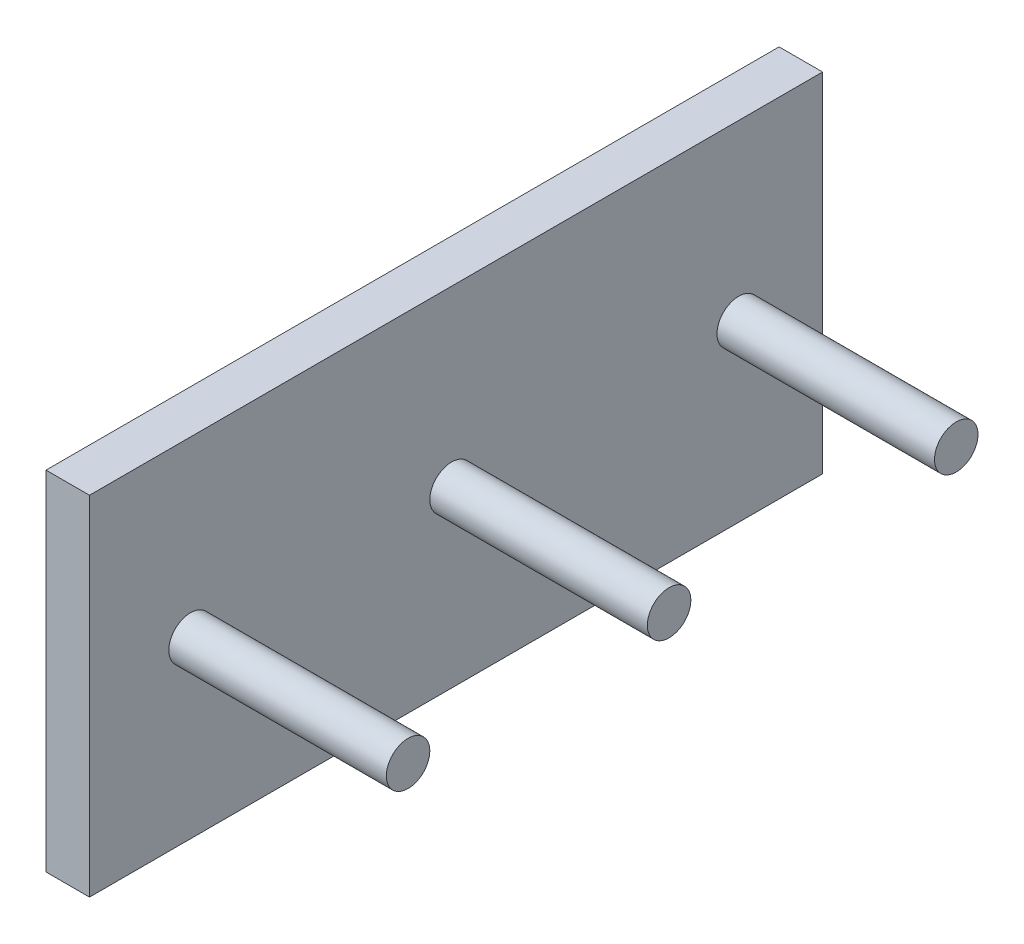
from build123d import *

# Parameters (mm, degrees)
SKETCH3_W           = 168.5
SKETCH3_H           = 80
BOSS_EXTRUDE1_DEPTH = 10
SKETCH4_R           = 5
BOSS_EXTRUDE2_DEPTH = 50
CUT_EXTRUDE1_START  = -10
CUT_EXTRUDE1_DEPTH  = 0.2


# Read off the part's stored shape, not the designer's step: Cut-Extrude1
with BuildPart() as part:
    # Sketch3 → Boss-Extrude1 (new body)
    with BuildSketch(Plane(origin=(0, 0, 0), x_dir=(0, 0, -1), z_dir=(1, 0, 0))):
        with Locations((-23.424575586, -20.604899774)):
            Rectangle(SKETCH3_W, SKETCH3_H)
    extrude(amount=-BOSS_EXTRUDE1_DEPTH)

    # Sketch4 → Boss-Extrude2 (add)
    with BuildSketch(Plane(origin=(0, 0, 0), x_dir=(0, 0, -1), z_dir=(1, 0, 0))):
        with Locations((41.54546204, -20.604899774)):
            Circle(SKETCH4_R)
        with Locations((-24.45453796, -20.604899774)):
            Circle(SKETCH4_R)
        with Locations((-84.45453796, -20.604899774)):
            Circle(SKETCH4_R)
    extrude(amount=BOSS_EXTRUDE2_DEPTH)

    # Cut-Extrude1 outline → Cut-Extrude1 (cut)
    # profile 1 of 9: a face of its own
    with BuildSketch(Plane.YZ.offset(CUT_EXTRUDE1_START)):
        with BuildLine():
            add(Edge.make_bspline(
                [(-24.952667893, -45.734619099), (-24.981132553, -45.735215217), (-25.037509108, -45.736395877), (-25.120290499, -45.749967563), (-25.20069136, -45.769851831), (-25.277717869, -45.799821321), (-25.352779189, -45.836400186), (-25.423906356, -45.882815283), (-25.492673589, -45.936615825), (-25.557247185, -45.998332169), (-25.61652552, -46.065865238), (-25.669256883, -46.137242589), (-25.713224576, -46.212581051), (-25.74910284, -46.291471924), (-25.777163959, -46.373933329), (-25.797495633, -46.459937533), (-25.809974028, -46.549626304), (-25.811269212, -46.610586741), (-25.811927709, -46.641580236)],
                knots=[0, 0, 0, 0, 0.061484255, 0.121774528, 0.18091956, 0.240256115, 0.300114444, 0.361145948, 0.423500582, 0.488669361, 0.553954105, 0.617581261, 0.680238427, 0.742187389, 0.804663212, 0.868258989, 0.933020257, 1, 1, 1, 1], degree=3))
            add(Edge.make_bspline(
                [(-25.811927709, -46.641580236), (-25.811463994, -46.665560869), (-25.810542405, -46.713220123), (-25.8023951, -46.783713724), (-25.790867942, -46.852783209), (-25.772567179, -46.919561879), (-25.750363064, -46.984910102), (-25.723023291, -47.048543665), (-25.690259829, -47.110493407), (-25.652799343, -47.1711065), (-25.609204103, -47.230228787), (-25.558428145, -47.287305732), (-25.501871866, -47.344210065), (-25.437999426, -47.399262203), (-25.367842737, -47.453575698), (-25.290745406, -47.506079684), (-25.207127378, -47.557860957), (-25.148285479, -47.590350702), (-25.118032477, -47.607054996)],
                knots=[0, 0, 0, 0, 0.057208269, 0.11369606, 0.169177916, 0.224159217, 0.278719878, 0.333794217, 0.389241459, 0.445822073, 0.503704281, 0.564293892, 0.627975416, 0.69503826, 0.765372726, 0.839611443, 0.91753775, 1, 1, 1, 1], degree=3))
            Line((-25.118032477, -47.607054996), (-24.957120017, -47.338655557))
            add(Edge.make_bspline(
                [(-24.957120017, -47.338655557), (-24.998906994, -47.313692584), (-25.078969231, -47.265864493), (-25.187153311, -47.186080046), (-25.279103267, -47.103409476), (-25.35428419, -47.017240581), (-25.413474251, -46.928099328), (-25.455386276, -46.835403793), (-25.481526482, -46.739466351), (-25.484701561, -46.674175813), (-25.486286683, -46.641580236)],
                knots=[0, 0, 0, 0, 0.159004299, 0.3046461, 0.438546905, 0.562322299, 0.677432543, 0.786897393, 0.893610889, 1, 1, 1, 1], degree=3))
            add(Edge.make_bspline(
                [(-25.486286683, -46.641580236), (-25.485511373, -46.61374287), (-25.483974319, -46.558555226), (-25.469205306, -46.477309477), (-25.446515732, -46.398404556), (-25.41402103, -46.323466721), (-25.374706832, -46.253529985), (-25.327221371, -46.192201054), (-25.27405717, -46.13918208), (-25.214745762, -46.095812383), (-25.150958063, -46.062538351), (-25.085484164, -46.036964117), (-25.017295534, -46.022771801), (-24.971384614, -46.020633889), (-24.94821577, -46.019554996)],
                knots=[0, 0, 0, 0, 0.091263605, 0.180930311, 0.27008822, 0.360156133, 0.448342532, 0.532665842, 0.613833704, 0.693981527, 0.772715977, 0.849335172, 0.923967327, 1, 1, 1, 1], degree=3))
            add(Edge.make_bspline(
                [(-24.94821577, -46.019554996), (-24.921780856, -46.020892406), (-24.86804254, -46.023611166), (-24.788758569, -46.046590438), (-24.710297452, -46.082739397), (-24.661764161, -46.116088367), (-24.636567132, -46.133402151)],
                knots=[0, 0, 0, 0, 0.234723374, 0.477158319, 0.728556284, 1, 1, 1, 1], degree=3))
            add(Edge.make_bspline(
                [(-24.636567132, -46.133402151), (-24.618381799, -46.147617637), (-24.580203968, -46.177461271), (-24.52337579, -46.228767015), (-24.464757652, -46.288970561), (-24.402111222, -46.356011643), (-24.33835015, -46.432332374), (-24.270433926, -46.515542333), (-24.200945353, -46.607765977), (-24.154343097, -46.672444806), (-24.1302971, -46.705818017)],
                knots=[0, 0, 0, 0, 0.090279215, 0.189529918, 0.299197872, 0.418925887, 0.548376285, 0.68813637, 0.839083502, 1, 1, 1, 1], degree=3))
            add(Edge.make_bspline(
                [(-24.1302971, -46.705818017), (-24.106504024, -46.739222642), (-24.061013475, -46.803089741), (-23.993500017, -46.892405741), (-23.931774507, -46.972274647), (-23.875255867, -47.042341469), (-23.823936433, -47.102575389), (-23.778309017, -47.153451055), (-23.737139644, -47.19367246), (-23.710432141, -47.216038594), (-23.69844113, -47.226080437)],
                knots=[0, 0, 0, 0, 0.181535301, 0.347081672, 0.495567816, 0.628357302, 0.74551967, 0.845830751, 0.930781807, 1, 1, 1, 1], degree=3))
            add(Edge.make_bspline(
                [(-23.69844113, -47.226080437), (-23.679753047, -47.240116246), (-23.643000423, -47.267719547), (-23.58555573, -47.304155852), (-23.526751768, -47.33512495), (-23.46643052, -47.359402209), (-23.405438834, -47.379845778), (-23.342980918, -47.393596187), (-23.279337029, -47.40220624), (-23.236507639, -47.403087971), (-23.215067733, -47.403529355)],
                knots=[0, 0, 0, 0, 0.133506769, 0.262558979, 0.388264447, 0.512667355, 0.63372227, 0.75539386, 0.877552945, 1, 1, 1, 1], degree=3))
            add(Edge.make_bspline(
                [(-23.215067733, -47.403529355), (-23.181476437, -47.402345344), (-23.115011837, -47.400002629), (-23.017919583, -47.38019016), (-22.925221905, -47.348918321), (-22.837836531, -47.305107958), (-22.75803882, -47.248631645), (-22.684910871, -47.183275654), (-22.623435085, -47.105432377), (-22.56972129, -47.020022498), (-22.527678915, -46.926535646), (-22.495964311, -46.828572469), (-22.477994484, -46.725977268), (-22.475415691, -46.656487282), (-22.474107196, -46.621227672)],
                knots=[0, 0, 0, 0, 0.083785371, 0.165779888, 0.246280008, 0.327460928, 0.408796954, 0.489715241, 0.571376032, 0.655523321, 0.741019483, 0.826546761, 0.911988852, 1, 1, 1, 1], degree=3))
            add(Edge.make_bspline(
                [(-22.474107196, -46.621227672), (-22.475397654, -46.583813381), (-22.477963962, -46.509408298), (-22.500277437, -46.399962224), (-22.53719876, -46.29458786), (-22.579098471, -46.209821469), (-22.620946256, -46.143479607), (-22.659064239, -46.092885771), (-22.702947373, -46.041616369), (-22.752712547, -45.989257848), (-22.808816385, -45.936697393), (-22.870874653, -45.88315469), (-22.9385081, -45.828504532), (-22.986790326, -45.79334743), (-23.011542092, -45.775324227)],
                knots=[0, 0, 0, 0, 0.107232799, 0.213251813, 0.318830447, 0.426793531, 0.483645951, 0.543603822, 0.60830765, 0.67712676, 0.750685636, 0.828713418, 0.912190348, 1, 1, 1, 1], degree=3))
            Line((-23.011542092, -45.775324227), (-23.206799504, -46.032911366))
            add(Edge.make_bspline(
                [(-23.206799504, -46.032911366), (-23.186761906, -46.048465176), (-23.148174178, -46.078418178), (-23.094134484, -46.123892784), (-23.044770964, -46.166754058), (-23.00189474, -46.20898192), (-22.963157805, -46.248346143), (-22.929992883, -46.286552317), (-22.902075021, -46.323050621), (-22.87228122, -46.369058105), (-22.842747821, -46.426859178), (-22.817756871, -46.499416578), (-22.802739065, -46.575241271), (-22.800753431, -46.626884579), (-22.799748222, -46.653028554)],
                knots=[0, 0, 0, 0, 0.098469431, 0.189629101, 0.274184089, 0.352183161, 0.423198873, 0.488550946, 0.548473346, 0.601440164, 0.701198082, 0.799591802, 0.898545098, 1, 1, 1, 1], degree=3))
            add(Edge.make_bspline(
                [(-22.799748222, -46.653028554), (-22.800847407, -46.685827685), (-22.802967081, -46.749077719), (-22.826117354, -46.838876005), (-22.862568041, -46.919696922), (-22.913653771, -46.989141035), (-22.974179243, -47.046959579), (-23.043828633, -47.088783816), (-23.120738384, -47.11395718), (-23.174388315, -47.117029019), (-23.201711363, -47.118593458)],
                knots=[0, 0, 0, 0, 0.143073084, 0.275902964, 0.402370856, 0.528413645, 0.650356379, 0.765895086, 0.880774131, 1, 1, 1, 1], degree=3))
            add(Edge.make_bspline(
                [(-23.201711363, -47.118593458), (-23.218721633, -47.118236835), (-23.252769987, -47.117523008), (-23.303072349, -47.107567299), (-23.353247635, -47.094777193), (-23.403070264, -47.074509235), (-23.453411575, -47.046528138), (-23.505138437, -47.009784157), (-23.558706773, -46.963507795), (-23.593547748, -46.928059362), (-23.611942733, -46.909343658)],
                knots=[0, 0, 0, 0, 0.107285214, 0.214745861, 0.32293856, 0.434116163, 0.553412311, 0.686072985, 0.834255992, 1, 1, 1, 1], degree=3))
            add(Edge.make_bspline(
                [(-23.611942733, -46.909343658), (-23.618144892, -46.902393699), (-23.632879802, -46.885882186), (-23.6570028, -46.855696168), (-23.686759601, -46.815833772), (-23.723578095, -46.767335918), (-23.766287707, -46.709308383), (-23.814342341, -46.641744786), (-23.869302007, -46.565398252), (-23.907726347, -46.511221943), (-23.928043494, -46.482575829)],
                knots=[0, 0, 0, 0, 0.052594282, 0.124951974, 0.218093899, 0.333502411, 0.468789179, 0.624937586, 0.801683048, 1, 1, 1, 1], degree=3))
            add(Edge.make_bspline(
                [(-23.928043494, -46.482575829), (-23.953118156, -46.448117179), (-24.001671763, -46.38139278), (-24.074620273, -46.286453404), (-24.145965035, -46.200371163), (-24.215250435, -46.122843829), (-24.28195092, -46.05310549), (-24.346868948, -45.991929844), (-24.409539431, -45.938693548), (-24.489887411, -45.881380971), (-24.588567394, -45.822817806), (-24.709469797, -45.772524439), (-24.830842173, -45.740812224), (-24.91241866, -45.736665206), (-24.952667893, -45.734619099)],
                knots=[0, 0, 0, 0, 0.09697231, 0.187773439, 0.272396139, 0.351320997, 0.424334774, 0.491908784, 0.55423322, 0.611267658, 0.716347845, 0.814540086, 0.908495456, 1, 1, 1, 1], degree=3))
        make_face()
    # profile 2 of 9: a face of its own
    with BuildSketch(Plane.YZ.offset(CUT_EXTRUDE1_START)):
        with BuildLine():
            add(Edge.make_bspline(
                [(-15.989955864, -58.653934749), (-15.834604127, -58.650632738), (-15.527208454, -58.644099024), (-15.074757903, -58.58859491), (-14.637081002, -58.503095552), (-14.216240998, -58.381037987), (-13.811420724, -58.221571693), (-13.421875442, -58.028539611), (-13.048263836, -57.79892184), (-12.815223613, -57.621367306), (-12.69792862, -57.531999653)],
                knots=[0, 0, 0, 0, 0.131331511, 0.259866667, 0.384897096, 0.508129446, 0.629848036, 0.752360482, 0.875356816, 1, 1, 1, 1], degree=3))
            add(Edge.make_bspline(
                [(-12.69792862, -57.531999653), (-12.574967626, -57.428703375), (-12.334700298, -57.226861149), (-12.023466889, -56.883654923), (-11.755930303, -56.5244829), (-11.538179004, -56.142627212), (-11.368509875, -55.740386898), (-11.250187146, -55.317185724), (-11.172436057, -54.874609611), (-11.165058766, -54.571885283), (-11.161310031, -54.418057346)],
                knots=[0, 0, 0, 0, 0.133704032, 0.26125936, 0.385087027, 0.506324071, 0.626690717, 0.74794424, 0.871919055, 1, 1, 1, 1], degree=3))
            add(Edge.make_bspline(
                [(-11.161310031, -54.418057346), (-11.165020067, -54.264230037), (-11.17230101, -53.962344026), (-11.250272758, -53.520569326), (-11.36933364, -53.099006935), (-11.534136212, -52.695735667), (-11.754770558, -52.317316899), (-12.017842869, -51.956542771), (-12.329667919, -51.615267354), (-12.568372128, -51.412679902), (-12.690296409, -51.309203179)],
                knots=[0, 0, 0, 0, 0.128405859, 0.251996429, 0.373557547, 0.493956724, 0.614886383, 0.738608902, 0.866487811, 1, 1, 1, 1], degree=3))
            add(Edge.make_bspline(
                [(-12.690296409, -51.309203179), (-12.807497851, -51.219675188), (-13.040926766, -51.041363203), (-13.415951696, -50.814221519), (-13.804843908, -50.618264064), (-14.211292699, -50.460342061), (-14.633760276, -50.338408126), (-15.072207281, -50.252568699), (-15.525508885, -50.197008164), (-15.833755031, -50.190543825), (-15.989955864, -50.187268083)],
                knots=[0, 0, 0, 0, 0.12438913, 0.24774456, 0.369366759, 0.491503751, 0.615172269, 0.739947855, 0.868221024, 1, 1, 1, 1], degree=3))
            add(Edge.make_bspline(
                [(-15.989955864, -50.187268083), (-16.146997463, -50.190451268), (-16.457021285, -50.196735357), (-16.914385465, -50.253829085), (-17.355933127, -50.349987478), (-17.785336091, -50.473984909), (-18.196410816, -50.645877153), (-18.59488548, -50.847624813), (-18.974963486, -51.092919235), (-19.338092388, -51.366447845), (-19.673690767, -51.668220859), (-19.96465526, -51.998891273), (-20.21491488, -52.348655263), (-20.415879876, -52.723048884), (-20.575471559, -53.116769998), (-20.68708594, -53.531925823), (-20.75465548, -53.968080767), (-20.763305833, -54.26601521), (-20.767720287, -54.418057346)],
                knots=[0, 0, 0, 0, 0.066265407, 0.130817915, 0.194141102, 0.256880934, 0.319162696, 0.381914779, 0.445165087, 0.509808828, 0.573661908, 0.635281894, 0.695365993, 0.754784322, 0.814205886, 0.874292118, 0.935848656, 1, 1, 1, 1], degree=3))
            add(Edge.make_bspline(
                [(-20.767720287, -54.418057346), (-20.763273868, -54.570097831), (-20.754536354, -54.868867662), (-20.68701257, -55.306675969), (-20.575951599, -55.723719662), (-20.415841276, -56.11814894), (-20.214898679, -56.492520743), (-19.964761566, -56.842426611), (-19.672884981, -57.1729595), (-19.33889043, -57.477267119), (-18.975651066, -57.751135615), (-18.594079348, -57.99309363), (-18.19659343, -58.19578013), (-17.78477742, -58.366181562), (-17.356791507, -58.495410597), (-16.913948845, -58.586257111), (-16.457089529, -58.644763376), (-16.147020409, -58.650851055), (-15.989955864, -58.653934749)],
                knots=[0, 0, 0, 0, 0.064101467, 0.125963715, 0.186348455, 0.245723819, 0.305095951, 0.365133335, 0.426705411, 0.490749979, 0.555343459, 0.618353033, 0.681056327, 0.743289665, 0.806083675, 0.869283795, 0.933786114, 1, 1, 1, 1], degree=3))
        make_face()
        with BuildLine():
            add(Edge.make_bspline(
                [(-19.627976697, -54.420601416), (-19.623260494, -54.281831116), (-19.613928913, -54.007257254), (-19.518907637, -53.605915282), (-19.37505878, -53.220889207), (-19.168608937, -52.858720703), (-18.912633472, -52.522488121), (-18.602692465, -52.221425726), (-18.243407582, -51.959625243), (-17.842652883, -51.73500489), (-17.41054112, -51.551800864), (-16.954054854, -51.422981447), (-16.481406834, -51.340542891), (-16.159902655, -51.331551211), (-15.997588076, -51.327011672)],
                knots=[0, 0, 0, 0, 0.0783479, 0.155020818, 0.231975183, 0.310137929, 0.389846351, 0.470221393, 0.553574395, 0.640540896, 0.729520414, 0.818318816, 0.908276449, 1, 1, 1, 1], degree=3))
            add(Edge.make_bspline(
                [(-15.997588076, -51.327011672), (-15.872005775, -51.330397195), (-15.62526941, -51.33704886), (-15.261089622, -51.376106329), (-14.912388543, -51.452765156), (-14.575299627, -51.548773893), (-14.256161146, -51.682148968), (-13.947264907, -51.835966932), (-13.656387723, -52.026024898), (-13.380183779, -52.238038481), (-13.128243745, -52.4689124), (-12.906842577, -52.714698996), (-12.720629884, -52.972587908), (-12.565983498, -53.240376863), (-12.448472017, -53.520209794), (-12.36388138, -53.810297302), (-12.311602832, -54.111739391), (-12.304594341, -54.316935453), (-12.30105362, -54.420601416)],
                knots=[0, 0, 0, 0, 0.070503408, 0.138520751, 0.205175423, 0.270690175, 0.334949695, 0.399023848, 0.464115338, 0.529616256, 0.594293975, 0.655642306, 0.71495908, 0.772521592, 0.828834671, 0.884867439, 0.941834518, 1, 1, 1, 1], degree=3))
            add(Edge.make_bspline(
                [(-12.30105362, -54.420601416), (-12.304528165, -54.525125673), (-12.311378091, -54.731191054), (-12.364302462, -55.034173973), (-12.447934347, -55.325391913), (-12.566044667, -55.605895935), (-12.720610942, -55.873711182), (-12.906855179, -56.131577794), (-13.128211334, -56.377429735), (-13.380307533, -56.608050586), (-13.65556096, -56.82074689), (-13.948191893, -57.007051677), (-14.255363774, -57.162712262), (-14.576486579, -57.290686191), (-14.911444593, -57.392861064), (-15.261547793, -57.463909453), (-15.625194156, -57.504471057), (-15.871980392, -57.51091259), (-15.997588076, -57.51419116)],
                knots=[0, 0, 0, 0, 0.058609208, 0.115545704, 0.172005201, 0.228288048, 0.285819656, 0.345104585, 0.406419982, 0.471062977, 0.53652873, 0.601329081, 0.665368835, 0.729415657, 0.795031618, 0.861553615, 0.929534443, 1, 1, 1, 1], degree=3))
            add(Edge.make_bspline(
                [(-15.997588076, -57.51419116), (-16.159895818, -57.509634467), (-16.481386457, -57.500608811), (-16.954134107, -57.418420248), (-17.409932589, -57.28875551), (-17.843140756, -57.109196066), (-18.244220254, -56.884289777), (-18.601912375, -56.619588542), (-18.912742412, -56.318856043), (-19.168580463, -55.982445188), (-19.375066214, -55.62032327), (-19.518905677, -55.235285007), (-19.613929414, -54.833946229), (-19.623260662, -54.559371935), (-19.627976697, -54.420601416)],
                knots=[0, 0, 0, 0, 0.091714371, 0.181663002, 0.270452517, 0.359238147, 0.446195944, 0.529825667, 0.610192664, 0.68989311, 0.768048033, 0.844994696, 0.921659941, 1, 1, 1, 1], degree=3))
        make_face(mode=Mode.SUBTRACT)
    # profile 3 of 9: a face of its own
    with BuildSketch(Plane.YZ.offset(CUT_EXTRUDE1_START)):
        with BuildLine():
            add(Edge.make_bspline(
                [(-14.249811633, -48.559062955), (-14.100491672, -48.556433557), (-13.803976545, -48.551212177), (-13.363056787, -48.515015744), (-12.930477821, -48.454742758), (-12.506264392, -48.366497741), (-12.089318506, -48.258750205), (-11.680168279, -48.122384559), (-11.279323599, -47.962486064), (-10.887447176, -47.779533173), (-10.510840883, -47.575151222), (-10.153315826, -47.350467278), (-9.816948189, -47.108215325), (-9.499703709, -46.849396738), (-9.208180716, -46.567856681), (-8.933503301, -46.272169495), (-8.681856251, -45.956644332), (-8.453155243, -45.622877075), (-8.247232381, -45.275811408), (-8.06843404, -44.916172297), (-7.918271563, -44.545030742), (-7.792280565, -44.164038489), (-7.699058526, -43.769541908), (-7.63111169, -43.365024277), (-7.585020324, -42.949598263), (-7.581191578, -42.66881626), (-7.579258749, -42.527071769)],
                knots=[0, 0, 0, 0, 0.044651779, 0.088668171, 0.132207846, 0.175179556, 0.218175953, 0.26092032, 0.304057092, 0.347169258, 0.390178367, 0.432113878, 0.473357381, 0.514075937, 0.554433565, 0.594455141, 0.634694671, 0.675001273, 0.715362885, 0.755284705, 0.794984396, 0.835002758, 0.875168701, 0.916068492, 0.95762966, 1, 1, 1, 1], degree=3))
            add(Edge.make_bspline(
                [(-7.579258749, -42.527071769), (-7.581409041, -42.411687958), (-7.585699964, -42.181438835), (-7.614210117, -41.8391489), (-7.660504692, -41.501270227), (-7.722744611, -41.16865663), (-7.807902967, -40.842032345), (-7.91037179, -40.520410888), (-8.028495355, -40.20259552), (-8.170210038, -39.890604043), (-8.330852121, -39.582412462), (-8.51160617, -39.276019394), (-8.716653264, -38.972800634), (-8.942759811, -38.670092234), (-9.19263246, -38.369692446), (-9.465421609, -38.072843664), (-9.758614714, -37.776163942), (-9.966493829, -37.584802966), (-10.072447851, -37.487268083)],
                knots=[0, 0, 0, 0, 0.059602645, 0.118937456, 0.177297226, 0.23571944, 0.293625312, 0.351536154, 0.410037148, 0.468661025, 0.528421226, 0.589501104, 0.65231576, 0.717412324, 0.78460646, 0.854061573, 0.925616562, 1, 1, 1, 1], degree=3))
            Line((-10.072447851, -37.487268083), (-10.998489518, -38.347163916))
            add(Edge.make_bspline(
                [(-10.998489518, -38.347163916), (-10.832693322, -38.501084531), (-10.50731501, -38.803156782), (-10.078547276, -39.298702167), (-9.715175256, -39.817953804), (-9.415634307, -40.353830787), (-9.178186657, -40.895634289), (-9.009670313, -41.435667689), (-8.900809788, -41.968936722), (-8.888097101, -42.323898382), (-8.881822851, -42.499086993)],
                knots=[0, 0, 0, 0, 0.141416926, 0.277533513, 0.408931547, 0.53715689, 0.660916574, 0.778177268, 0.890521088, 1, 1, 1, 1], degree=3))
            add(Edge.make_bspline(
                [(-8.881822851, -42.499086993), (-8.883318397, -42.606051803), (-8.886306143, -42.819742215), (-8.924750313, -43.1374149), (-8.979775066, -43.452151307), (-9.058821767, -43.762576892), (-9.161465241, -44.069248847), (-9.285943807, -44.372069738), (-9.434633545, -44.670875583), (-9.604422247, -44.963511576), (-9.790526751, -45.248294008), (-9.998426999, -45.515207816), (-10.21896838, -45.768733774), (-10.459669547, -46.002444758), (-10.714515748, -46.221659743), (-10.984443165, -46.426497338), (-11.272452626, -46.611670153), (-11.57462025, -46.779037534), (-11.88647979, -46.927047596), (-12.202322005, -47.062604849), (-12.525971878, -47.169152328), (-12.851053665, -47.2631902), (-13.182280191, -47.330710958), (-13.516695147, -47.381954374), (-13.856572524, -47.41352049), (-14.084381553, -47.417379133), (-14.198930223, -47.419319365)],
                knots=[0, 0, 0, 0, 0.039897159, 0.079705095, 0.119250487, 0.159088605, 0.199121103, 0.239850603, 0.281179432, 0.323575387, 0.366059846, 0.408029581, 0.449740774, 0.491367834, 0.533110233, 0.575139589, 0.617715896, 0.66078224, 0.703956598, 0.746511727, 0.788946646, 0.8310284, 0.872739592, 0.914992372, 0.957255817, 1, 1, 1, 1], degree=3))
            add(Edge.make_bspline(
                [(-14.198930223, -47.419319365), (-14.316053041, -47.41767024), (-14.549923232, -47.414377278), (-14.897862831, -47.378284253), (-15.242524346, -47.329809193), (-15.581837332, -47.253938255), (-15.91821146, -47.161401951), (-16.248270268, -47.042277141), (-16.575830699, -46.908805139), (-16.894213635, -46.750284507), (-17.204235043, -46.577150275), (-17.496764417, -46.381944061), (-17.774675667, -46.175110579), (-18.03308535, -45.947932013), (-18.277351632, -45.708552797), (-18.501362527, -45.449115273), (-18.710651006, -45.177228214), (-18.901468767, -44.890101966), (-19.070597406, -44.590042685), (-19.222387229, -44.282920639), (-19.346296375, -43.966599664), (-19.448460966, -43.643512205), (-19.531105205, -43.314210639), (-19.584799527, -42.976982281), (-19.623838656, -42.633988687), (-19.626586175, -42.402527718), (-19.627976697, -42.28538507)],
                knots=[0, 0, 0, 0, 0.042266522, 0.084397556, 0.126178976, 0.167853704, 0.209823139, 0.252040846, 0.294454579, 0.337446665, 0.380356918, 0.422557972, 0.464316953, 0.505328561, 0.546677025, 0.587688633, 0.628959954, 0.670481466, 0.712024416, 0.753237786, 0.794056968, 0.8345291, 0.875516704, 0.916486009, 0.957733478, 1, 1, 1, 1], degree=3))
            add(Edge.make_bspline(
                [(-19.627976697, -42.28538507), (-19.624503514, -42.145296791), (-19.617660104, -41.869272869), (-19.56504079, -41.46331693), (-19.482702562, -41.072698879), (-19.362117155, -40.699785869), (-19.208261071, -40.344033591), (-19.022805881, -40.003690874), (-18.798911629, -39.682389845), (-18.545729494, -39.3780175), (-18.264662965, -39.097048847), (-17.960878322, -38.843774361), (-17.636698534, -38.622357721), (-17.293399495, -38.429341981), (-16.929061317, -38.269771316), (-16.544100741, -38.140087583), (-16.140518965, -38.036150348), (-15.861546104, -37.996040029), (-15.72028439, -37.975729621)],
                knots=[0, 0, 0, 0, 0.065695602, 0.129443791, 0.191706383, 0.252719989, 0.312945246, 0.373297803, 0.434207579, 0.496345511, 0.558790825, 0.620368518, 0.681606057, 0.742692241, 0.804853088, 0.867877295, 0.933097866, 1, 1, 1, 1], degree=3))
            Line((-15.72028439, -37.975729621), (-15.72028439, -41.557780903))
            Line((-15.72028439, -41.557780903), (-14.417720287, -41.557780903))
            Line((-14.417720287, -41.557780903), (-14.417720287, -36.835986031))
            add(Edge.make_bspline(
                [(-14.417720287, -36.835986031), (-14.660421934, -36.84215272), (-15.13499306, -36.854210867), (-15.827470195, -36.925007119), (-16.48214412, -37.043351205), (-17.096830384, -37.212478767), (-17.67561983, -37.422217233), (-18.214324818, -37.682316027), (-18.713943056, -37.990178311), (-19.173521395, -38.339308434), (-19.586565687, -38.728860272), (-19.94820483, -39.152678927), (-20.252674382, -39.610726), (-20.500406419, -40.100522773), (-20.695750348, -40.620568718), (-20.831846859, -41.172986258), (-20.914838152, -41.757089599), (-20.925225683, -42.157052947), (-20.9305408, -42.361707185)],
                knots=[0, 0, 0, 0, 0.075673612, 0.147969788, 0.21678684, 0.282852908, 0.346509057, 0.408473489, 0.469011293, 0.52919006, 0.588105644, 0.64569153, 0.702522862, 0.759161978, 0.816472856, 0.875340366, 0.936213849, 1, 1, 1, 1], degree=3))
            add(Edge.make_bspline(
                [(-20.9305408, -42.361707185), (-20.928472849, -42.487271379), (-20.924387712, -42.735317345), (-20.895347452, -43.102089813), (-20.850989787, -43.45913901), (-20.783302458, -43.806121371), (-20.70122303, -44.144109477), (-20.59562944, -44.47069776), (-20.472899441, -44.787330001), (-20.333729844, -45.095769918), (-20.17344509, -45.393019503), (-19.993477501, -45.6791485), (-19.798355945, -45.957548868), (-19.58105244, -46.223983397), (-19.346944592, -46.48254242), (-19.090752284, -46.728192134), (-18.820506106, -46.968774633), (-18.626623219, -47.116116853), (-18.528938236, -47.190353019)],
                knots=[0, 0, 0, 0, 0.067117235, 0.132586838, 0.196575355, 0.259344685, 0.321465687, 0.38239591, 0.442673365, 0.502926951, 0.563166892, 0.623040692, 0.68353935, 0.744780765, 0.806714573, 0.869870681, 0.934436296, 1, 1, 1, 1], degree=3))
            add(Edge.make_bspline(
                [(-18.528938236, -47.190353019), (-18.373936263, -47.300148461), (-18.065441702, -47.518670175), (-17.571436649, -47.792696452), (-17.064252567, -48.033671966), (-16.534894191, -48.222413866), (-15.989373322, -48.374437495), (-15.424906817, -48.479215054), (-14.843494374, -48.549185337), (-14.449306134, -48.55574379), (-14.249811633, -48.559062955)],
                knots=[0, 0, 0, 0, 0.124568295, 0.247923565, 0.370169094, 0.492698055, 0.61623773, 0.741431016, 0.869140971, 1, 1, 1, 1], degree=3))
        make_face()
    # profile 4 of 9: a face of its own
    with BuildSketch(Plane.YZ.offset(CUT_EXTRUDE1_START)):
        with BuildLine():
            Line((-7.904899774, -14.855216801), (-7.904899774, -12.626611031))
            add(Edge.make_bspline(
                [(-7.904899774, -12.626611031), (-7.905457941, -12.477360165), (-7.906526783, -12.19155718), (-7.912630137, -11.78182128), (-7.929928994, -11.409649532), (-7.944802771, -11.074322813), (-7.972085574, -10.776842948), (-7.997699916, -10.516772348), (-8.032614686, -10.294171493), (-8.063653056, -10.159572463), (-8.077896569, -10.097804942)],
                knots=[0, 0, 0, 0, 0.176318523, 0.337635294, 0.48402062, 0.616443186, 0.734080377, 0.83685581, 0.9251331, 1, 1, 1, 1], degree=3))
            add(Edge.make_bspline(
                [(-8.077896569, -10.097804942), (-8.100925671, -10.016715756), (-8.146730387, -9.855429956), (-8.24285352, -9.623892603), (-8.354145331, -9.402209127), (-8.484257584, -9.191964634), (-8.635190689, -8.995967906), (-8.804517744, -8.812128807), (-8.991028357, -8.637833267), (-9.195940322, -8.477248527), (-9.414322604, -8.327796983), (-9.648602976, -8.201590878), (-9.894838175, -8.09463369), (-10.151726038, -8.003616613), (-10.422845129, -7.940784277), (-10.704062401, -7.886640489), (-10.998848243, -7.860643717), (-11.199436464, -7.856193308), (-11.301233909, -7.853934749)],
                knots=[0, 0, 0, 0, 0.059586608, 0.118517331, 0.177003634, 0.234933501, 0.293126792, 0.351720678, 0.411569431, 0.473498649, 0.53572642, 0.598541313, 0.661402023, 0.725526704, 0.791000942, 0.858071685, 0.927972142, 1, 1, 1, 1], degree=3))
            add(Edge.make_bspline(
                [(-11.301233909, -7.853934749), (-11.470291287, -7.859457379), (-11.799297519, -7.870205088), (-12.277573611, -7.949510829), (-12.723912334, -8.084996224), (-13.136625131, -8.272863036), (-13.510407901, -8.509364026), (-13.838899995, -8.794748476), (-14.114311892, -9.12970371), (-14.306152711, -9.442535235), (-14.42897126, -9.719239445), (-14.514823941, -9.945983471), (-14.580836559, -10.193818684), (-14.640625877, -10.459145574), (-14.685363306, -10.743893318), (-14.71824653, -11.047818978), (-14.738684152, -11.370412617), (-14.741775513, -11.591992121), (-14.743361313, -11.705657506)],
                knots=[0, 0, 0, 0, 0.086017901, 0.167401304, 0.245904775, 0.322771765, 0.397482056, 0.470279214, 0.543222076, 0.617388103, 0.656214586, 0.69718173, 0.740637698, 0.786607807, 0.835566388, 0.887231382, 0.942152193, 1, 1, 1, 1], degree=3))
            Line((-14.743361313, -11.705657506), (-20.604899774, -7.691114237))
            Line((-20.604899774, -7.691114237), (-20.604899774, -9.136146288))
            Line((-20.604899774, -9.136146288), (-14.743361313, -13.148145487))
            Line((-14.743361313, -13.148145487), (-14.743361313, -13.715473211))
            Line((-14.743361313, -13.715473211), (-20.604899774, -13.715473211))
            Line((-20.604899774, -13.715473211), (-20.604899774, -14.855216801))
            Line((-20.604899774, -14.855216801), (-7.904899774, -14.855216801))
        make_face()
        with BuildLine():
            add(Edge.make_bspline(
                [(-13.458605704, -11.789611833), (-13.458642907, -11.699697503), (-13.458715249, -11.524856148), (-13.444283532, -11.272145309), (-13.427840419, -11.036960413), (-13.402376647, -10.820495809), (-13.370226528, -10.622449657), (-13.328983472, -10.442454403), (-13.282172157, -10.280383292), (-13.207402762, -10.09024728), (-13.091130467, -9.877234538), (-12.92101842, -9.645962021), (-12.707286735, -9.452348389), (-12.465457793, -9.286251548), (-12.197440462, -9.155873192), (-11.911139577, -9.060247697), (-11.609655921, -9.003115941), (-11.403240705, -8.996851384), (-11.298689838, -8.993678339)],
                knots=[0, 0, 0, 0, 0.066583561, 0.129473912, 0.187427875, 0.241186189, 0.290855261, 0.335957518, 0.377891215, 0.415682887, 0.487067703, 0.557040256, 0.627266078, 0.699567987, 0.773728584, 0.847221173, 0.92261637, 1, 1, 1, 1], degree=3))
            add(Edge.make_bspline(
                [(-11.298689838, -8.993678339), (-11.19659603, -8.996509705), (-10.99489404, -9.002103504), (-10.701180245, -9.064386631), (-10.419693028, -9.156673237), (-10.160597544, -9.293977195), (-9.921018609, -9.452508139), (-9.718108737, -9.643858848), (-9.549385073, -9.856890216), (-9.4411081, -10.057988731), (-9.374357739, -10.237674968), (-9.328935652, -10.392292683), (-9.290554225, -10.567369439), (-9.261660353, -10.763040814), (-9.235536524, -10.979263487), (-9.218507068, -11.216114639), (-9.208197595, -11.473203513), (-9.207714524, -11.651373064), (-9.207463877, -11.743818564)],
                knots=[0, 0, 0, 0, 0.077145446, 0.152412672, 0.226287986, 0.300630166, 0.373613592, 0.443083963, 0.510743122, 0.578508733, 0.614864747, 0.655682647, 0.700373382, 0.750387549, 0.805315729, 0.865170821, 0.930042195, 1, 1, 1, 1], degree=3))
            Line((-9.207463877, -11.743818564), (-9.207463877, -13.715473211))
            Line((-9.207463877, -13.715473211), (-13.44079721, -13.715473211))
            Line((-13.44079721, -13.715473211), (-13.458605704, -11.789611833))
        make_face(mode=Mode.SUBTRACT)
    # profile 5 of 9: a face of its own
    with BuildSketch(Plane.YZ.offset(CUT_EXTRUDE1_START)):
        Polygon((-25.730517452, -45.083337047), (-22.555517452, -45.083337047), (-22.555517452, -43.292311406), (-22.881158478, -43.292311406), (-22.881158478, -44.79840115), (-23.858081555, -44.79840115), (-23.858081555, -43.292311406), (-24.183722581, -43.292311406), (-24.183722581, -44.79840115), (-25.404876427, -44.79840115), (-25.404876427, -43.292311406), (-25.730517452, -43.292311406), align=None)
    # profile 6 of 9: a face of its own
    with BuildSketch(Plane.YZ.offset(CUT_EXTRUDE1_START)):
        Polygon((-22.555517452, -41.460580637), (-22.555517452, -41.419875509), (-25.730517452, -39.954490893), (-25.730517452, -40.264231478), (-24.712889247, -40.733612488), (-24.712889247, -42.172920381), (-25.730517452, -42.655021743), (-25.730517452, -42.966670381), align=None)
        Polygon((-24.387248222, -40.883712648), (-23.174998622, -41.443408161), (-24.387248222, -42.017732079), align=None, mode=Mode.SUBTRACT)
    # profile 7 of 9: a face of its own
    with BuildSketch(Plane.YZ.offset(CUT_EXTRUDE1_START)):
        Polygon((-22.555517452, -39.384619099), (-22.555517452, -39.324833441), (-25.054430714, -37.227247304), (-22.555517452, -37.227247304), (-22.555517452, -36.942311406), (-25.730517452, -36.942311406), (-25.730517452, -37.007185204), (-23.23732835, -39.099683201), (-25.730517452, -39.099683201), (-25.730517452, -39.384619099), align=None)
    # profile 8 of 9: a face of its own
    with BuildSketch(Plane.YZ.offset(CUT_EXTRUDE1_START)):
        Polygon((-20.604899774, -34.556498852), (-7.904899774, -34.556498852), (-7.904899774, -28.206498852), (-9.207463877, -28.206498852), (-9.207463877, -33.416755262), (-13.115156185, -33.416755262), (-13.115156185, -28.206498852), (-14.417720287, -28.206498852), (-14.417720287, -33.416755262), (-19.302335672, -33.416755262), (-19.302335672, -28.206498852), (-20.604899774, -28.206498852), align=None)
    # profile 9 of 9: a face of its own
    with BuildSketch(Plane.YZ.offset(CUT_EXTRUDE1_START)):
        Polygon((-7.904899774, -21.856498852), (-7.904899774, -21.693678339), (-20.604899774, -16.971883467), (-20.604899774, -18.208301737), (-16.534386954, -19.716935551), (-16.534386954, -24.138530102), (-20.604899774, -25.807440358), (-20.604899774, -27.066755262), align=None)
        Polygon((-15.231822851, -20.202853019), (-10.884006345, -21.820881865), (-15.231822851, -23.604275294), align=None, mode=Mode.SUBTRACT)
    extrude(amount=CUT_EXTRUDE1_DEPTH, mode=Mode.SUBTRACT)


solid = part.part
